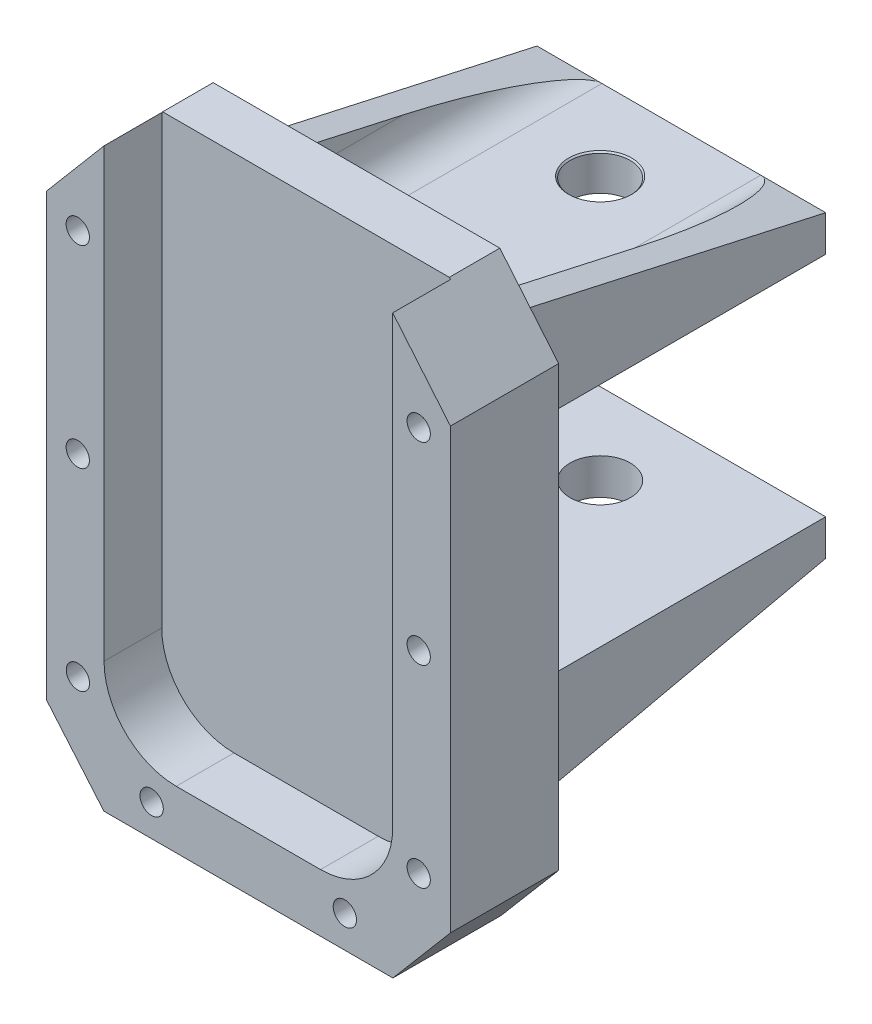
from build123d import *

# Parameters (mm, degrees)
SKETCH1_W                      = 35.56
SKETCH1_H                      = 50.8
BOSS_EXTRUDE1_DEPTH            = 9.525
SKETCH2_W                      = 25.4
SKETCH2_H                      = 45.72
CUT_EXTRUDE2_DEPTH             = 5.08
TAP_DRILL_FOR_M2_5X0_45_TAP1_D = 2.05
SKETCH13_W                     = 25.4
SKETCH13_H                     = 3.175
BOSS_EXTRUDE2_DEPTH            = 28.575
CUT_EXTRUDE3_DEPTH             = 73.778867812
FILLET1_R                      = 6.35
M5_CLEARANCE_HOLE1_D           = 5.3
M5_CLEARANCE_HOLE1_CSINK_D     = 5.55
M5_CLEARANCE_HOLE1_CSINK_ANGLE = 90
RIB7_REACH                     = 67.774
SKETCH14_WALL_W                = 162.819779212
SKETCH14_WALL_H                = 2.54
RIB8_REACH                     = 67.774
SKETCH15_WALL_W                = 162.819779212
SKETCH15_WALL_H                = 2.54
RIB9_REACH                     = 67.774
SKETCH17_WALL_W                = 162.819779212
SKETCH17_WALL_H                = 2.54
RIB10_REACH                    = 67.774
SKETCH16_WALL_W                = 162.819779212
SKETCH16_WALL_H                = 2.54
FILLET2_R                      = 3.175
FILLET3_R                      = 3.175


with BuildPart() as part:
    # Sketch1 → Boss-Extrude1 (new body)
    with BuildSketch(Plane.XY):
        with Locations((-17.78, 25.4)):
            Rectangle(SKETCH1_W, SKETCH1_H)
    extrude(amount=BOSS_EXTRUDE1_DEPTH)

    # Sketch2 → Cut-Extrude2 (cut)
    with BuildSketch(Plane.XY.offset(9.525)):
        with Locations((-17.78, 27.94)):
            Rectangle(SKETCH2_W, SKETCH2_H)
    extrude(amount=-CUT_EXTRUDE2_DEPTH, mode=Mode.SUBTRACT)

    # Tap Drill for M2.5x0.45 Tap1 (through all)
    with Locations(Plane(origin=(0, 0, 0), x_dir=(-1, 0, 0), z_dir=(0, 0, -1))):
        with Locations((2.792369004, 43.087106138), (2.792369004, 26.092979092), (2.792369004, 9.105182099), (9.290740849, 2.822744672), (26.292369004, 2.787106138), (32.780032006, 9.105182099), (32.792369004, 26.087106138), (32.792369004, 43.087106138)):
            Hole(TAP_DRILL_FOR_M2_5X0_45_TAP1_D / 2)

    # Sketch13 → Boss-Extrude2 (add)
    with BuildSketch(Plane(origin=(0, 0, 0), x_dir=(-1, 0, 0), z_dir=(0, 0, -1))):
        with Locations((17.78, 37.677545037)):
            Rectangle(SKETCH13_W, SKETCH13_H)
        with Locations((17.78, 14.502545037)):
            Rectangle(SKETCH13_W, SKETCH13_H)
    extrude(amount=BOSS_EXTRUDE2_DEPTH)

    # Sketch8 → Cut-Extrude3 (cut, through all)
    with BuildSketch(Plane.XY.offset(9.525)):
        Polygon((-5.178964387, 50.8), (0, 44.591495864), (0, 50.8), align=None)
        Polygon((-35.56, 44.706622517), (-35.56, 50.8), (-30.402645731, 50.8), align=None)
        Polygon((-35.56, 5.970049098), (-35.56, 0), (-30.492594088, 0), align=None)
        Polygon((-5.092594088, -0.031324356), (0, 0), (0, 5.970049098), align=None)
    extrude(amount=-CUT_EXTRUDE3_DEPTH, mode=Mode.SUBTRACT)

    # Fillet1
    fillet1_edges = [part.edges().sort_by_distance(p)[0] for p in [
        (-5.08, 5.08, 6.985),
        (-30.48, 5.08, 6.985),
    ]]
    fillet(fillet1_edges, radius=FILLET1_R)

    # M5 Clearance Hole1 (through all)
    with Locations(Plane(origin=(-17.78, 39.265045037, -7.14375), x_dir=(0, 0, 1), z_dir=(0, 1, 0))):
        with Locations((0, 0), (-14.2875, 0)):
            CounterSinkHole(M5_CLEARANCE_HOLE1_D / 2, M5_CLEARANCE_HOLE1_CSINK_D / 2, counter_sink_angle=M5_CLEARANCE_HOLE1_CSINK_ANGLE)

    # Sketch14 wall → Rib7 (add, up to next)
    with BuildSketch(Plane(origin=(-30.48, 9.740045037, -14.2875), x_dir=(0, -0.216930457819, 0.976187060184), z_dir=(0, 0.976187060184, 0.216930457819)), mode=Mode.PRIVATE) as rib7_sk1:
        with Locations((0, 1.27)):
            Rectangle(SKETCH14_WALL_W, SKETCH14_WALL_H)
    rib7_tool1 = extrude(rib7_sk1.sketch, amount=RIB7_REACH, mode=Mode.PRIVATE) - part.part
    add(rib7_tool1.solids().sort_by_distance((-30.48, 9.740045037, -14.2875))[0])

    # Sketch15 wall → Rib8 (add, up to next)
    with BuildSketch(Plane(origin=(-5.08, 9.740045037, -14.2875), x_dir=(0, -0.216930457819, 0.976187060184), z_dir=(0, -0.976187060184, -0.216930457819)), mode=Mode.PRIVATE) as rib8_sk1:
        with Locations((0, 1.27)):
            Rectangle(SKETCH15_WALL_W, SKETCH15_WALL_H)
    rib8_tool1 = extrude(rib8_sk1.sketch, amount=-RIB8_REACH, mode=Mode.PRIVATE) - part.part
    add(rib8_tool1.solids().sort_by_distance((-5.08, 9.740045037, -14.2875))[0])

    # Sketch17 wall → Rib9 (add, up to next)
    with BuildSketch(Plane(origin=(-5.08, 42.440045037, -14.2875), x_dir=(0, 0.216930457819, 0.976187060184), z_dir=(0, -0.976187060184, 0.216930457819)), mode=Mode.PRIVATE) as rib9_sk1:
        with Locations((0, 1.27)):
            Rectangle(SKETCH17_WALL_W, SKETCH17_WALL_H)
    rib9_tool1 = extrude(rib9_sk1.sketch, amount=RIB9_REACH, mode=Mode.PRIVATE) - part.part
    add(rib9_tool1.solids().sort_by_distance((-5.08, 42.440045037, -14.2875))[0])

    # Sketch16 wall → Rib10 (add, up to next)
    with BuildSketch(Plane(origin=(-30.48, 42.440045037, -14.2875), x_dir=(0, 0.216930457819, 0.976187060184), z_dir=(0, 0.976187060184, -0.216930457819)), mode=Mode.PRIVATE) as rib10_sk1:
        with Locations((0, 1.27)):
            Rectangle(SKETCH16_WALL_W, SKETCH16_WALL_H)
    rib10_tool1 = extrude(rib10_sk1.sketch, amount=-RIB10_REACH, mode=Mode.PRIVATE) - part.part
    add(rib10_tool1.solids().sort_by_distance((-30.48, 42.440045037, -14.2875))[0])

    # Fillet2
    fillet2_edges = [part.edges().sort_by_distance(p)[0] for p in [
        (-27.94, 12.915045037, -14.2875),
        (-7.62, 12.915045037, -14.2875),
    ]]
    fillet(fillet2_edges, radius=FILLET2_R)

    # Fillet3
    fillet3_edges = [part.edges().sort_by_distance(p)[0] for p in [
        (-7.62, 39.265045037, -14.2875),
        (-27.94, 39.265045037, -14.2875),
    ]]
    fillet(fillet3_edges, radius=FILLET3_R)


solid = part.part
